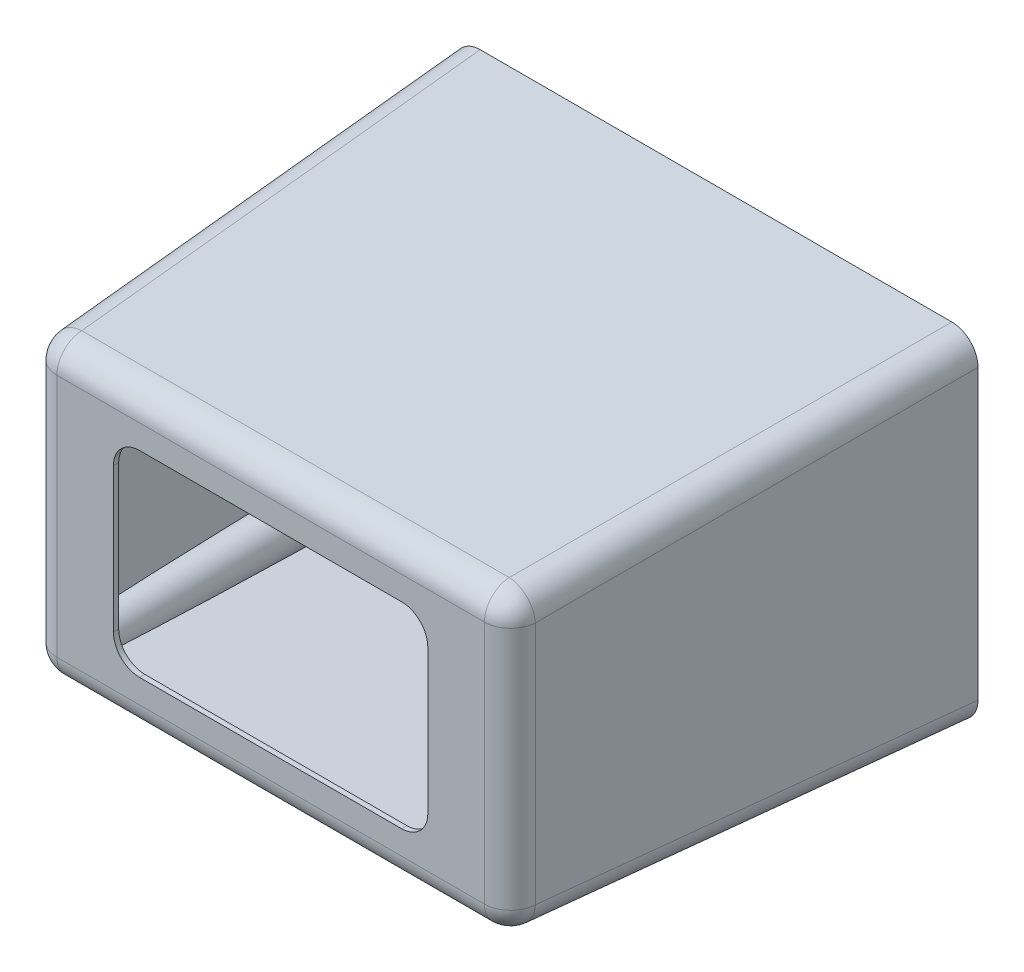
from build123d import *

# Parameters (mm, degrees)
SKIZZE1_W                       = 200
SKIZZE1_H                       = 130
AUFSATZ_LINEAR_AUSTRAGEN1_DEPTH = 170
AUFSATZ_LINEAR_AUSTRAGEN1_TAPER = 3
VERRUNDUNG1_R                   = 10
WANDUNG3_T                      = 2
SCHNITT_LINEAR_AUSTRAGEN1_DEPTH = 2
AUFSATZ_LINEAR_AUSTRAGEN2_REACH = 208.032
SKIZZE4_R                       = 8.011008819
SCHNITT_LINEAR_START            = -2
SCHNITT_LINEAR_AUSTRAGEN2_DEPTH = 2
SKIZZE4_5_R                     = 8.011008819
SCHNITT_LINEAR_AUSTRAGEN3_DEPTH = 2
SKIZZE7_R                       = 2
SCHNITT_LINEAR_AUSTRAGEN4_DEPTH = 20


# Read off the part's stored shape, not the designer's step: Schnitt-Linear austragen2
with BuildPart() as part:
    # Skizze1 → Aufsatz-Linear austragen1 (new body)
    with BuildSketch(Plane.XY):
        Rectangle(SKIZZE1_W, SKIZZE1_H)
    extrude(amount=AUFSATZ_LINEAR_AUSTRAGEN1_DEPTH, taper=AUFSATZ_LINEAR_AUSTRAGEN1_TAPER)

    # Verrundung1
    verrundung1_edges = [part.edges().sort_by_distance(p)[0] for p in [
        (-91.090677522, 0, 170),
        (0, -56.090677522, 170),
        (91.090677522, 0, 170),
        (95.545338761, -60.545338761, 85),
        (-95.545338761, -60.545338761, 85),
        (-95.545338761, 60.545338761, 85),
        (95.545338761, 60.545338761, 85),
        (0, 56.090677522, 170),
    ]]
    fillet(verrundung1_edges, radius=VERRUNDUNG1_R)

    # Wandung3 (no face opened: a closed hollow body)
    add(offset(amount=-WANDUNG3_T, mode=Mode.PRIVATE), mode=Mode.SUBTRACT)

    # Skizze2 → Schnitt-Linear austragen1 (cut)
    with BuildSketch(Plane.XY.offset(170)):
        with BuildLine():
            Line((-50, -37.5), (50, -37.5))
            ThreePointArc((50, -37.5), (57.071067812, -34.571067812), (60, -27.5))
            Line((60, -27.5), (60, 27.5))
            ThreePointArc((60, 27.5), (57.071067812, 34.571067812), (50, 37.5))
            Line((50, 37.5), (-50, 37.5))
            ThreePointArc((-50, 37.5), (-57.071067812, 34.571067812), (-60, 27.5))
            Line((-60, 27.5), (-60, -27.5))
            ThreePointArc((-60, -27.5), (-57.071067812, -34.571067812), (-50, -37.5))
        make_face()
    extrude(amount=-SCHNITT_LINEAR_AUSTRAGEN1_DEPTH, mode=Mode.SUBTRACT)


with BuildPart() as body_2:

    # Skizze4 → Aufsatz-Linear austragen2 (new, up to next)
    with BuildSketch(Plane.XY.offset(2), mode=Mode.PRIVATE) as aufsatz_linear_austragen2_sk1:
        with Locations((-89.881460981, 54.881460981)):
            Circle(SKIZZE4_R)
    aufsatz_linear_austragen2_tool1 = extrude(aufsatz_linear_austragen2_sk1.sketch, amount=AUFSATZ_LINEAR_AUSTRAGEN2_REACH, mode=Mode.PRIVATE) - part.part
    # Skizze4 → Aufsatz-Linear austragen2 (new, up to next)
    with BuildSketch(Plane.XY.offset(2), mode=Mode.PRIVATE) as aufsatz_linear_austragen2_sk2:
        with Locations((89.881460981, 54.881460981)):
            Circle(SKIZZE4_R)
    aufsatz_linear_austragen2_tool2 = extrude(aufsatz_linear_austragen2_sk2.sketch, amount=AUFSATZ_LINEAR_AUSTRAGEN2_REACH, mode=Mode.PRIVATE) - part.part
    # Skizze4 → Aufsatz-Linear austragen2 (new, up to next)
    with BuildSketch(Plane.XY.offset(2), mode=Mode.PRIVATE) as aufsatz_linear_austragen2_sk3:
        with Locations((89.881460981, -54.881460981)):
            Circle(SKIZZE4_R)
    aufsatz_linear_austragen2_tool3 = extrude(aufsatz_linear_austragen2_sk3.sketch, amount=AUFSATZ_LINEAR_AUSTRAGEN2_REACH, mode=Mode.PRIVATE) - part.part
    # Skizze4 → Aufsatz-Linear austragen2 (new, up to next)
    with BuildSketch(Plane.XY.offset(2), mode=Mode.PRIVATE) as aufsatz_linear_austragen2_sk4:
        with Locations((-89.881460981, -54.881460981)):
            Circle(SKIZZE4_R)
    aufsatz_linear_austragen2_tool4 = extrude(aufsatz_linear_austragen2_sk4.sketch, amount=AUFSATZ_LINEAR_AUSTRAGEN2_REACH, mode=Mode.PRIVATE) - part.part
    add(aufsatz_linear_austragen2_tool1.solids().sort_by_distance((-89.881461, 54.881461, 2))[0])
    add(aufsatz_linear_austragen2_tool2.solids().sort_by_distance((89.881461, 54.881461, 2))[0])
    add(aufsatz_linear_austragen2_tool3.solids().sort_by_distance((89.881461, -54.881461, 2))[0])
    add(aufsatz_linear_austragen2_tool4.solids().sort_by_distance((-89.881461, -54.881461, 2))[0])

    # Skizze7 → Schnitt-Linear austragen4 (cut)
    with BuildSketch(Plane(origin=(0, 0, 2), x_dir=(-1, 0, 0), z_dir=(0, 0, -1))):
        with Locations((-89.881460981, 54.881460981)):
            Circle(SKIZZE7_R)
        with Locations((89.881460981, 54.881460981)):
            Circle(SKIZZE7_R)
        with Locations((89.881460981, -54.881460981)):
            Circle(SKIZZE7_R)
        with Locations((-89.881460981, -54.881460981)):
            Circle(SKIZZE7_R)
    extrude(amount=-SCHNITT_LINEAR_AUSTRAGEN4_DEPTH, mode=Mode.SUBTRACT)


with BuildPart() as part_1:
    add(part.part)

    # Schnitt-Linear austragen2 outline → Schnitt-Linear austragen2 (cut)
    with BuildSketch(Plane.XY.offset(2).offset(SCHNITT_LINEAR_START)):
        with BuildLine():
            ThreePointArc((-97.892439749, -54.859518492), (-84.216822322, -49.216822322), (-89.859518492, -62.892439749))
            Line((-89.859518492, -62.892439749), (89.859518492, -62.892439749))
            ThreePointArc((89.859518492, -62.892439749), (84.216822322, -49.216822322), (97.892439749, -54.859518492))
            Line((97.892439749, -54.859518492), (97.892439749, 54.859518492))
            ThreePointArc((97.892439749, 54.859518492), (84.216822322, 49.216822322), (89.859518492, 62.892439749))
            Line((89.859518492, 62.892439749), (-89.859518492, 62.892439749))
            ThreePointArc((-89.859518492, 62.892439749), (-84.216822322, 49.216822322), (-97.892439749, 54.859518492))
            Line((-97.892439749, 54.859518492), (-97.892439749, -54.859518492))
        make_face()
    extrude(amount=SCHNITT_LINEAR_AUSTRAGEN2_DEPTH, mode=Mode.SUBTRACT)

    # Skizze4<5> → Schnitt-Linear austragen3 (cut)
    with BuildSketch(Plane.XY.offset(2).offset(SCHNITT_LINEAR_START)):
        with Locations((-89.881460981, 54.881460981)):
            Circle(SKIZZE4_5_R)
        with Locations((89.881460981, 54.881460981)):
            Circle(SKIZZE4_5_R)
        with Locations((89.881460981, -54.881460981)):
            Circle(SKIZZE4_5_R)
        with Locations((-89.881460981, -54.881460981)):
            Circle(SKIZZE4_5_R)
    extrude(amount=SCHNITT_LINEAR_AUSTRAGEN3_DEPTH, mode=Mode.SUBTRACT)


solid = Compound([body_2.part, part_1.part])
